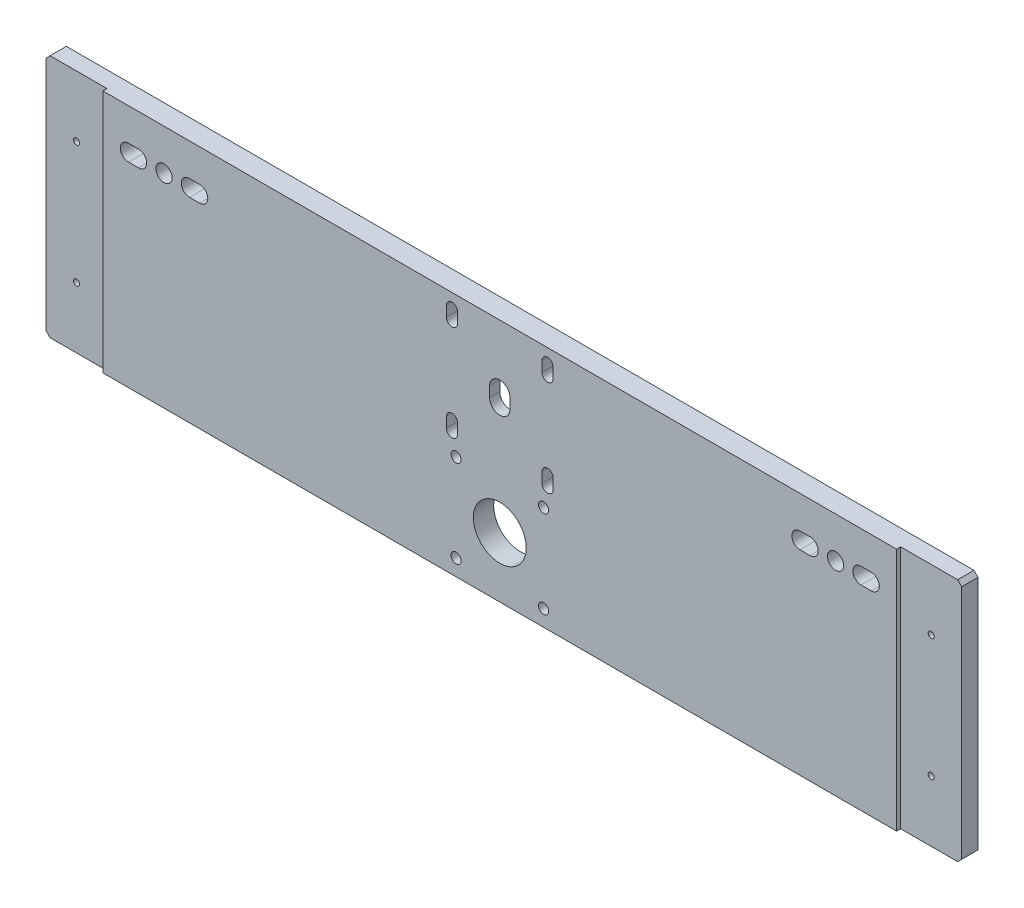
from build123d import *

# Parameters (mm, degrees)
SCHIZZO1_R                   = 13
SCHIZZO1_R_2                 = 4
SCHIZZO1_R_3                 = 1.5
SCHIZZO1_R_4                 = 2.5
ESTRUSIONE_ESTRUSIONE1_DEPTH = 10
SCHIZZO2_W                   = 30
SCHIZZO2_H                   = 120
TAGLIO_ESTRUSIONE1_DEPTH     = 2
TAGLIO_ESTRUSIONE2_DEPTH     = 3
TAGLIO_ESTRUSIONE5_DEPTH     = 5


with BuildPart() as part:
    # Schizzo1 → Estrusione-Estrusione1 (new body)
    with BuildSketch(Plane.XY):
        Polygon((2, 0), (448, 0), (450, 2), (450, 118), (448, 120), (2, 120), (0, 118), (0, 2), align=None)
        with Locations((225, 29.5)):
            Circle(SCHIZZO1_R, mode=Mode.SUBTRACT)
        with Locations((390, 100)):
            Circle(SCHIZZO1_R_2, mode=Mode.SUBTRACT)
        with Locations((60, 100)):
            Circle(SCHIZZO1_R_2, mode=Mode.SUBTRACT)
        with Locations((15, 30)):
            Circle(SCHIZZO1_R_3, mode=Mode.SUBTRACT)
        with Locations((435, 30)):
            Circle(SCHIZZO1_R_3, mode=Mode.SUBTRACT)
        with Locations((203.5, 51)):
            Circle(SCHIZZO1_R_4, mode=Mode.SUBTRACT)
        with Locations((246.5, 51)):
            Circle(SCHIZZO1_R_4, mode=Mode.SUBTRACT)
        with Locations((246.5, 8)):
            Circle(SCHIZZO1_R_4, mode=Mode.SUBTRACT)
        with Locations((203.5, 8)):
            Circle(SCHIZZO1_R_4, mode=Mode.SUBTRACT)
        with Locations((435, 90)):
            Circle(SCHIZZO1_R_3, mode=Mode.SUBTRACT)
        with Locations((15, 90)):
            Circle(SCHIZZO1_R_3, mode=Mode.SUBTRACT)
        with BuildLine():
            Line((407.5, 96), (402.5, 96))
            ThreePointArc((402.5, 96), (398.5, 100), (402.5, 104))
            Line((402.5, 104), (407.5, 104))
            ThreePointArc((407.5, 104), (411.5, 100), (407.5, 96))
        make_face(mode=Mode.SUBTRACT)
        with BuildLine():
            Line((377.5, 96), (372.5, 96))
            ThreePointArc((372.5, 96), (368.5, 100), (372.5, 104))
            Line((372.5, 104), (377.5, 104))
            ThreePointArc((377.5, 104), (381.5, 100), (377.5, 96))
        make_face(mode=Mode.SUBTRACT)
        with BuildLine():
            Line((42.5, 96), (47.5, 96))
            ThreePointArc((47.5, 96), (51.5, 100), (47.5, 104))
            Line((47.5, 104), (42.5, 104))
            ThreePointArc((42.5, 104), (38.5, 100), (42.5, 96))
        make_face(mode=Mode.SUBTRACT)
        with BuildLine():
            Line((72.5, 96), (77.5, 96))
            ThreePointArc((77.5, 96), (81.5, 100), (77.5, 104))
            Line((77.5, 104), (72.5, 104))
            ThreePointArc((72.5, 104), (68.5, 100), (72.5, 96))
        make_face(mode=Mode.SUBTRACT)
        with BuildLine():
            Line((220, 84.5), (220, 89.5))
            ThreePointArc((220, 89.5), (225, 94.5), (230, 89.5))
            Line((230, 89.5), (230, 84.5))
            ThreePointArc((230, 84.5), (225, 79.5), (220, 84.5))
        make_face(mode=Mode.SUBTRACT)
        with BuildLine():
            Line((204.25, 113.1), (204.25, 108.1))
            ThreePointArc((204.25, 108.1), (201.5, 105.35), (198.75, 108.1))
            Line((198.75, 108.1), (198.75, 113.1))
            ThreePointArc((198.75, 113.1), (201.5, 115.85), (204.25, 113.1))
        make_face(mode=Mode.SUBTRACT)
        with BuildLine():
            Line((245.75, 113.1), (245.75, 108.1))
            ThreePointArc((245.75, 108.1), (248.5, 105.35), (251.25, 108.1))
            Line((251.25, 108.1), (251.25, 113.1))
            ThreePointArc((251.25, 113.1), (248.5, 115.85), (245.75, 113.1))
        make_face(mode=Mode.SUBTRACT)
        with BuildLine():
            Line((204.25, 60.9), (204.25, 65.9))
            ThreePointArc((204.25, 65.9), (201.5, 68.65), (198.75, 65.9))
            Line((198.75, 65.9), (198.75, 60.9))
            ThreePointArc((198.75, 60.9), (201.5, 58.15), (204.25, 60.9))
        make_face(mode=Mode.SUBTRACT)
        with BuildLine():
            Line((245.75, 60.9), (245.75, 65.9))
            ThreePointArc((245.75, 65.9), (248.5, 68.65), (251.25, 65.9))
            Line((251.25, 65.9), (251.25, 60.9))
            ThreePointArc((251.25, 60.9), (248.5, 58.15), (245.75, 60.9))
        make_face(mode=Mode.SUBTRACT)
    extrude(amount=-ESTRUSIONE_ESTRUSIONE1_DEPTH)

    # Schizzo2 → Taglio-Estrusione1 (cut)
    with BuildSketch(Plane.XY):
        with Locations((15, 60)):
            Rectangle(SCHIZZO2_W, SCHIZZO2_H)
        with Locations((435, 60)):
            Rectangle(SCHIZZO2_W, SCHIZZO2_H)
    extrude(amount=-TAGLIO_ESTRUSIONE1_DEPTH, mode=Mode.SUBTRACT)

    # Schizzo3 → Taglio-Estrusione2 (cut)
    with BuildSketch(Plane.XY.offset(-10)):
        with BuildLine():
            Line((248.5, 57), (201.5, 57))
            ThreePointArc((201.5, 57), (197.964466094, 58.464466094), (196.5, 62))
            Line((196.5, 62), (196.5, 112))
            ThreePointArc((196.5, 112), (197.964466094, 115.535533906), (201.5, 117))
            Line((201.5, 117), (248.5, 117))
            ThreePointArc((248.5, 117), (252.035533906, 115.535533906), (253.5, 112))
            Line((253.5, 112), (253.5, 62))
            ThreePointArc((253.5, 62), (252.035533906, 58.464466094), (248.5, 57))
        make_face()
    extrude(amount=TAGLIO_ESTRUSIONE2_DEPTH, mode=Mode.SUBTRACT)

    # Schizzo4 → Taglio-Estrusione5 (cut)
    with BuildSketch(Plane.XY.offset(-10)):
        with BuildLine():
            Line((239.5, 57), (210.5, 57))
            ThreePointArc((210.5, 57), (206.964466094, 58.464466094), (205.5, 62))
            Line((205.5, 62), (205.5, 112))
            ThreePointArc((205.5, 112), (206.964466094, 115.535533906), (210.5, 117))
            Line((210.5, 117), (239.5, 117))
            ThreePointArc((239.5, 117), (243.035533906, 115.535533906), (244.5, 112))
            Line((244.5, 112), (244.5, 62))
            ThreePointArc((244.5, 62), (243.035533906, 58.464466094), (239.5, 57))
        make_face()
    extrude(amount=TAGLIO_ESTRUSIONE5_DEPTH, mode=Mode.SUBTRACT)


solid = part.part
